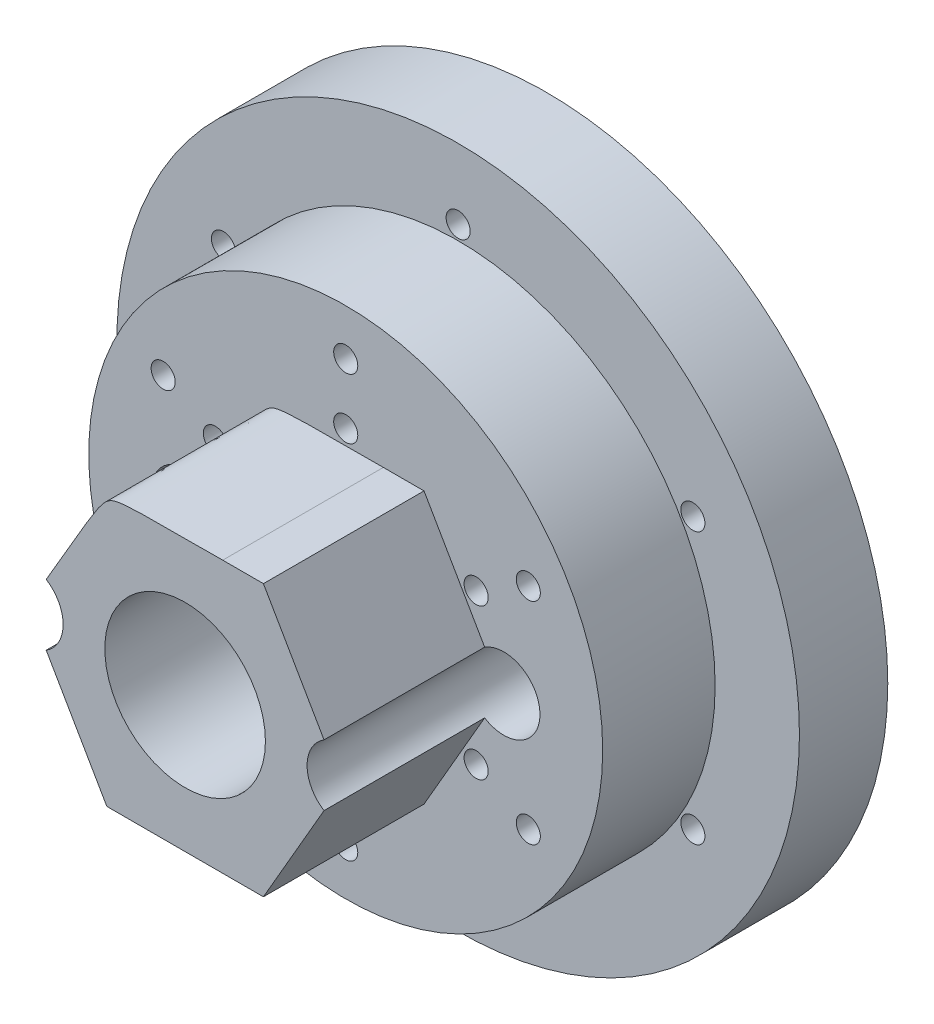
from build123d import *

# Parameters (mm, degrees)
SKETCH1_R               = 17
BOSS_EXTRUDE1_DEPTH     = 4.4
CAVITY1_OUTLINE_R       = 3.15
CAVITY1_DEPTH           = 3.283595969
CAVITY1_START           = 1.183595969
CAVITY1_2_OUTLINE_R     = 3.15
CAVITY1_2_OUTLINE_R_2   = 1.575
CAVITY1_2_DEPTH         = 2.1
SKETCH9_R               = 12.8
BOSS_EXTRUDE3_DEPTH     = 5.6
BOSS_EXTRUDE8_DEPTH     = 8
SKETCH2_R               = 0.6
CUT_EXTRUDE1_DEPTH      = 31.033314835
CIRPATTERN1_COUNT       = 6
SKETCH3_R               = 4.596048158
CUT_EXTRUDE2_DEPTH      = 3.283595969
CUT_EXTRUDE3_DEPTH      = 31.033314835
CUT_EXTRUDE3_DEPTH_BACK = 4
SKETCH4_R               = 4
SKETCH6_R               = 1.8
CUT_EXTRUDE4_DEPTH      = 31.033314835
FILLET1_START           = 10
FILLET1_DEPTH           = 9


with BuildPart() as part:
    # Sketch1 → Boss-Extrude1 (new body)
    with BuildSketch(Plane.XY):
        Circle(SKETCH1_R)
    extrude(amount=BOSS_EXTRUDE1_DEPTH)

    # Cavity1: read off the stored shape, not the designer's step
    # Cavity1 outline → Cavity1 (cut)
    with BuildSketch(Plane.XY):
        with BuildLine():
            Line((3.9375, 6.819950055), (2.048148228, 15.163776711))
            ThreePointArc((2.048148228, 15.163776711), (0, 16.8), (-2.048148228, 15.163776711))
            Line((-2.048148228, 15.163776711), (-3.9375, 6.819950055))
            Line((-3.9375, 6.819950055), (-12.108141735, 9.355636751))
            ThreePointArc((-12.108141735, 9.355636751), (-14.549226784, 8.4), (-14.156289963, 5.80813996))
            Line((-14.156289963, 5.80813996), (-7.875, 0))
            Line((-7.875, 0), (-14.156289963, -5.80813996))
            ThreePointArc((-14.156289963, -5.80813996), (-14.549226784, -8.4), (-12.108141735, -9.355636751))
            Line((-12.108141735, -9.355636751), (-3.9375, -6.819950055))
            Line((-3.9375, -6.819950055), (-2.048148228, -15.163776711))
            ThreePointArc((-2.048148228, -15.163776711), (0, -16.8), (2.048148228, -15.163776711))
            Line((2.048148228, -15.163776711), (3.9375, -6.819950055))
            Line((3.9375, -6.819950055), (12.108141735, -9.355636751))
            ThreePointArc((12.108141735, -9.355636751), (14.549226784, -8.4), (14.156289963, -5.80813996))
            Line((14.156289963, -5.80813996), (7.875, 0))
            Line((7.875, 0), (14.156289963, 5.80813996))
            ThreePointArc((14.156289963, 5.80813996), (14.549226784, 8.4), (12.108141735, 9.355636751))
            Line((12.108141735, 9.355636751), (3.9375, 6.819950055))
        make_face()
        Circle(CAVITY1_OUTLINE_R, mode=Mode.SUBTRACT)
    extrude(amount=CAVITY1_DEPTH, mode=Mode.SUBTRACT)

    # Cavity1 2 outline → Cavity1 2 (cut)
    with BuildSketch(Plane.XY.offset(CAVITY1_START)):
        Circle(CAVITY1_2_OUTLINE_R)
        Circle(CAVITY1_2_OUTLINE_R_2, mode=Mode.SUBTRACT)
    extrude(amount=CAVITY1_2_DEPTH, mode=Mode.SUBTRACT)

    # Sketch9 → Boss-Extrude3 (add)
    with BuildSketch(Plane.XY.offset(4.4)):
        Circle(SKETCH9_R)
    extrude(amount=BOSS_EXTRUDE3_DEPTH)

    # Sketch12 → Boss-Extrude8 (add)
    with BuildSketch(Plane.XY.offset(10)):
        Polygon((3.9, -6.75499815), (7.8, 0), (3.9, 6.75499815), (-3.9, 6.75499815), (-7.8, 0), (-3.9, -6.75499815), align=None)
    extrude(amount=BOSS_EXTRUDE8_DEPTH)

    # Sketch2 → Cut-Extrude1 (cut, through all)
    with BuildSketch(Plane(origin=(0, 0, 0), x_dir=(-1, 0, 0), z_dir=(0, 0, -1))):
        with Locations(Location((0, 13.5, 0), (0, 0, 180))):
            Circle(SKETCH2_R)
        with Locations(Location((0, 10.5, 0), (0, 0, 180))):
            Circle(SKETCH2_R)
        with Locations(Location((0, 7.5, 0), (0, 0, 180))):
            Circle(SKETCH2_R)
    cut_extrude1 = extrude(amount=-CUT_EXTRUDE1_DEPTH, mode=Mode.SUBTRACT)

    # CirPattern1: Cut-Extrude1 ×6 about axis
    cirpattern1_axis = Axis((0, 0, 0), (0, 0, 1))
    for i in range(1, CIRPATTERN1_COUNT):
        add(cut_extrude1.rotate(cirpattern1_axis, i * 360 / CIRPATTERN1_COUNT), mode=Mode.SUBTRACT)

    # Sketch3 → Cut-Extrude2 (cut)
    with BuildSketch(Plane(origin=(0, 0, 0), x_dir=(-1, 0, 0), z_dir=(0, 0, -1))):
        Circle(SKETCH3_R)
    extrude(amount=-CUT_EXTRUDE2_DEPTH, mode=Mode.SUBTRACT)

    # Sketch4 → Cut-Extrude3 (cut, two sides: drawn at the far end of the back side and taken through both)
    with BuildSketch(Plane.XY.offset(-CUT_EXTRUDE3_DEPTH_BACK)):
        Circle(SKETCH4_R)
    extrude(amount=CUT_EXTRUDE3_DEPTH + CUT_EXTRUDE3_DEPTH_BACK, mode=Mode.SUBTRACT)

    # Sketch6 → Cut-Extrude4 (cut, through all)
    with BuildSketch(Plane(origin=(0, 0, 0), x_dir=(-1, 0, 0), z_dir=(0, 0, -1))):
        with Locations(Location((-7.875, 0, 0), (0, 0, 302.067932294))):
            Circle(SKETCH6_R)
        with Locations(Location((7.875, 0, 0), (0, 0, 42.758730598))):
            Circle(SKETCH6_R)
    extrude(amount=-CUT_EXTRUDE4_DEPTH, mode=Mode.SUBTRACT)

    # Fillet1: read off the stored shape, not the designer's step
    # Fillet1 outline → Fillet1 (cut)
    with BuildSketch(Plane.XY.offset(FILLET1_START)):
        with BuildLine():
            Line((-3.9, 6.75499815), (-6.786751346, 1.75499815))
            add(Edge.make_bspline(
                [(-6.786751346, 1.75499815), (-3.9, 6.75499815), (1.873502692, 6.75499815)],
                knots=[0, 0, 0, 1, 1, 1], degree=2, weights=[1, 9, 1]))
            Line((1.873502692, 6.75499815), (-3.9, 6.75499815))
        make_face()
    extrude(amount=FILLET1_DEPTH, mode=Mode.SUBTRACT)


solid = part.part
